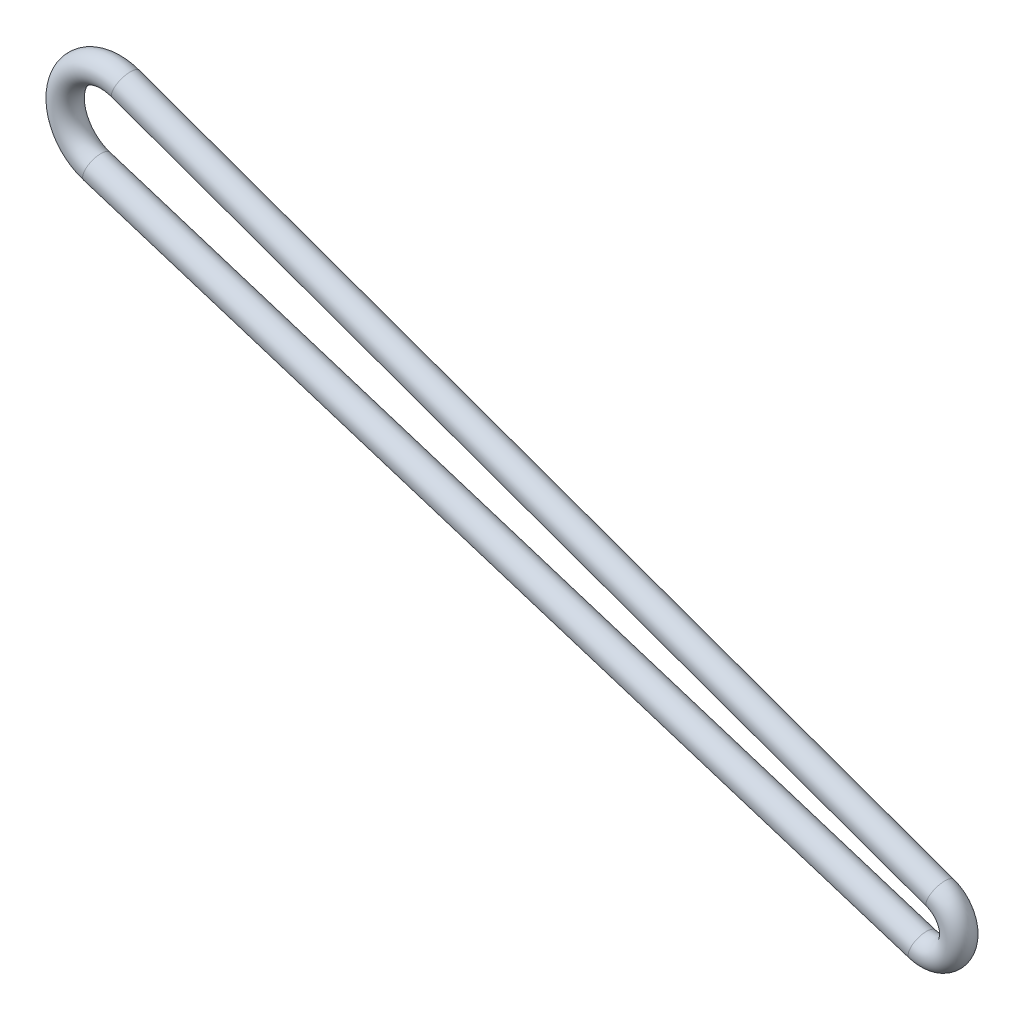
from build123d import *

# Parameters (mm, degrees)
SWEEP_19_PROFILE_R = 1.5


with BuildPart() as part:
    # 扫描19: sweep along a path in 草图2
    with BuildLine(Plane.XY) as sweep_19_path:
        Line((358.239228946, 265.088804776), (267.067392951, 293.898552003))
        ThreePointArc((267.067392951, 293.898552003), (263.83717488, 300.267151447), (270.268693203, 303.370204737))
        Line((270.268693203, 303.370204737), (360.224035102, 270.961229471))
        ThreePointArc((360.224035102, 270.961229471), (362.110077738, 267.052138446), (358.239228946, 265.088804776))
    # 扫描19 profile (on start of the path) → 扫描19 (sweep)
    with BuildSketch(Plane(origin=(358.239228946, 265.088804776, 0), x_dir=(-0.3013086432096117, -0.9535266653466923, 0), z_dir=(-0.9535266653466923, 0.3013086432096117, 0))):
        Circle(SWEEP_19_PROFILE_R)
    sweep(path=sweep_19_path.line)


solid = part.part
